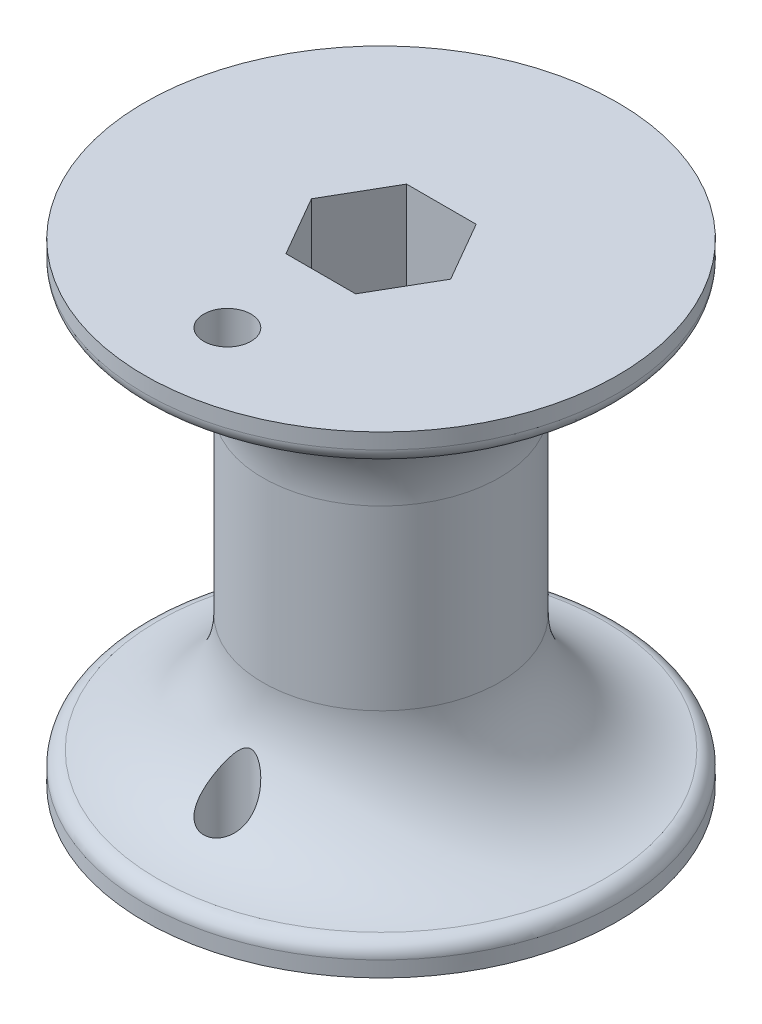
from build123d import *

# Parameters (mm, degrees)
SKETCH2_R          = 2.54
CUT_EXTRUDE1_DEPTH = 63.217039467
FILLET1_R          = 1.5875


with BuildPart() as part:
    # Sketch1 → Revolve1 (revolve)
    with BuildSketch(Plane(origin=(0, 0, 0), x_dir=(0, 0, -1), z_dir=(1, 0, 0))):
        with BuildLine():
            Line((0, 0), (0, 25.4))
            Line((0, 25.4), (25.4, 25.4))
            Line((25.4, 25.4), (25.4, 22.225))
            ThreePointArc((25.4, 22.225), (16.419743879, 18.505256121), (12.7, 9.525))
            Line((12.7, 9.525), (12.7, 0))
            Line((12.7, 0), (0, 0))
        make_face()
    revolve1 = revolve(axis=Axis((0, 0, 0), (0, 1, 0)))

    # Mirror1: Revolve1 across plane
    add(revolve1.mirror(Plane(origin=(0, 0, -12.7), x_dir=(0, 0, 1), z_dir=(0, -1, 0))))

    # Sketch2 → Cut-Extrude1 (cut, through all)
    with BuildSketch(Plane(origin=(0, 25.4, 0), x_dir=(1, 0, 0), z_dir=(0, 1, 0))):
        with Locations((0, -16.51)):
            Circle(SKETCH2_R)
        Polygon((-3.739497694, -6.477), (3.739497694, -6.477), (7.478995387, 0), (3.739497694, 6.477), (-3.739497694, 6.477), (-7.478995387, 0), align=None)
    extrude(amount=-CUT_EXTRUDE1_DEPTH, mode=Mode.SUBTRACT)

    # Fillet1
    fillet1_edges = [part.edges().sort_by_distance(p)[0] for p in [
        (0, -22.225, 25.4),
        (0, 22.225, 25.4),
    ]]
    fillet(fillet1_edges, radius=FILLET1_R)


solid = part.part
